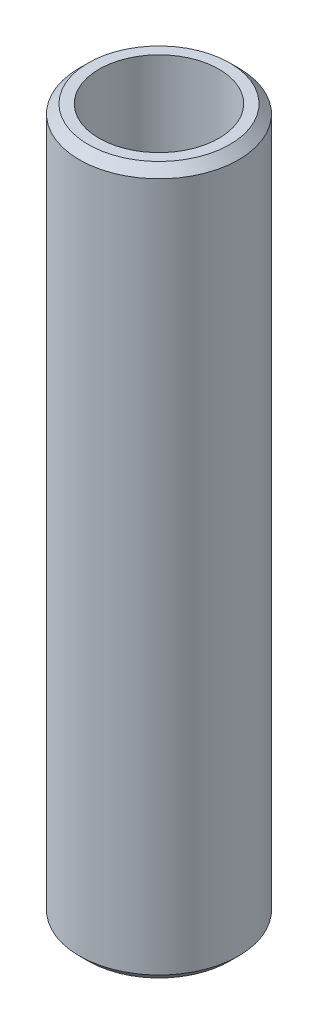
from build123d import *

# Parameters (mm, degrees)
SKETCH1_R           = 52.5
BOSS_EXTRUDE1_DEPTH = 466.586146643
SKETCH2_R           = 39.544092747
CUT_EXTRUDE1_DEPTH  = 473.456487138
CHAMFER1_SIZE       = 5.808741772


with BuildPart() as part:
    # Sketch1 → Boss-Extrude1 (new body)
    with BuildSketch(Plane(origin=(0, 0, 0), x_dir=(1, 0, 0), z_dir=(0, 1, 0))):
        Circle(SKETCH1_R)
    extrude(amount=BOSS_EXTRUDE1_DEPTH)

    # Sketch2 → Cut-Extrude1 (cut, through all)
    with BuildSketch(Plane(origin=(0, 0, 0), x_dir=(1, 0, 0), z_dir=(0, 1, 0))):
        Circle(SKETCH2_R)
    extrude(amount=CUT_EXTRUDE1_DEPTH, mode=Mode.SUBTRACT)

    # Chamfer1
    chamfer1_edges = [part.edges().sort_by_distance(p)[0] for p in [
        (-52.5, 466.586146643, 0),
        (-52.5, 0, 0),
    ]]
    chamfer(chamfer1_edges, length=CHAMFER1_SIZE)


solid = part.part
